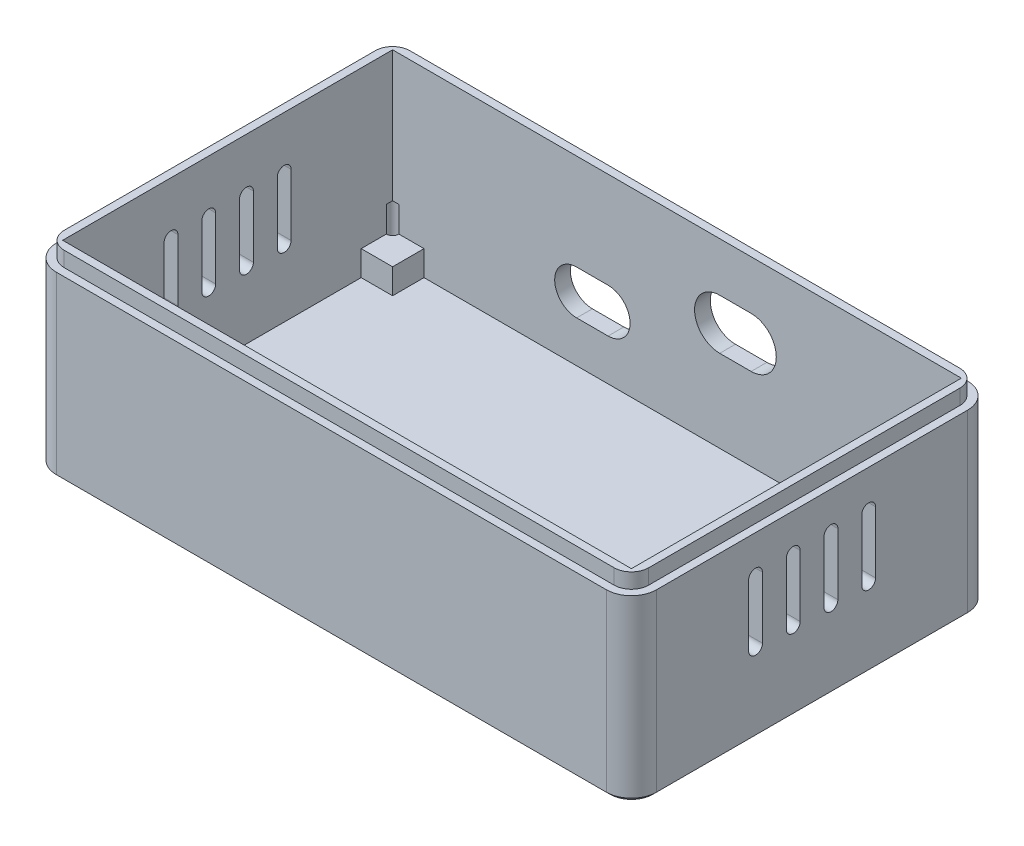
from build123d import *

# Parameters (mm, degrees)
CUERPO_DEPTH                  = 28.5
CROQUIS_HUECO_PCB_W           = 90.5
CROQUIS_HUECO_PCB_H           = 52.5
HUECO_PCB_DEPTH               = 26.5
CROQUIS_LABIO_W               = 90.5
CROQUIS_LABIO_H               = 52.5
LABIO_LIP_DEPTH               = 2.4
CROQUIS_APOYOS_W              = 5
CROQUIS_APOYOS_H              = 5
APOYOS_PCB_DEPTH              = 4
CROQUIS_ALIVIOS_R             = 1
ALIVIOS_ESQUINAS_DEPTH        = 8.1
SALIDAS_USB_Y_PANEL_DEPTH     = 64.729388825
VENTILAS_LATERALES_DEPTH      = 64.729388825
VENTILAS_LATERALES_DEPTH_BACK = 64.729388825
CHAFLAN_BASE_SIZE             = 0.6


with BuildPart() as part:
    # Croquis_contorno → Cuerpo (new body)
    with BuildSketch(Plane(origin=(0, 0, 0), x_dir=(1, 0, 0), z_dir=(0, 1, 0))):
        with BuildLine():
            Line((-43.75, -28.75), (43.75, -28.75))
            ThreePointArc((43.75, -28.75), (46.578427125, -27.578427125), (47.75, -24.75))
            Line((47.75, -24.75), (47.75, 24.75))
            ThreePointArc((47.75, 24.75), (46.578427125, 27.578427125), (43.75, 28.75))
            Line((43.75, 28.75), (-43.75, 28.75))
            ThreePointArc((-43.75, 28.75), (-46.578427125, 27.578427125), (-47.75, 24.75))
            Line((-47.75, 24.75), (-47.75, -24.75))
            ThreePointArc((-47.75, -24.75), (-46.578427125, -27.578427125), (-43.75, -28.75))
        make_face()
    extrude(amount=CUERPO_DEPTH)

    # Croquis_hueco_PCB → Hueco_PCB (cut)
    with BuildSketch(Plane(origin=(0, 28.5, 0), x_dir=(1, 0, 0), z_dir=(0, 1, 0))):
        Rectangle(CROQUIS_HUECO_PCB_W, CROQUIS_HUECO_PCB_H)
    extrude(amount=-HUECO_PCB_DEPTH, mode=Mode.SUBTRACT)

    # Croquis_labio → Labio_lip (add)
    with BuildSketch(Plane(origin=(0, 28.5, 0), x_dir=(1, 0, 0), z_dir=(0, 1, 0))):
        with BuildLine():
            Line((-43.75, -27.5), (43.75, -27.5))
            ThreePointArc((43.75, -27.5), (45.694543648, -26.694543648), (46.5, -24.75))
            Line((46.5, -24.75), (46.5, 24.75))
            ThreePointArc((46.5, 24.75), (45.694543648, 26.694543648), (43.75, 27.5))
            Line((43.75, 27.5), (-43.75, 27.5))
            ThreePointArc((-43.75, 27.5), (-45.694543648, 26.694543648), (-46.5, 24.75))
            Line((-46.5, 24.75), (-46.5, -24.75))
            ThreePointArc((-46.5, -24.75), (-45.694543648, -26.694543648), (-43.75, -27.5))
        make_face()
        Rectangle(CROQUIS_LABIO_W, CROQUIS_LABIO_H, mode=Mode.SUBTRACT)
    extrude(amount=LABIO_LIP_DEPTH)

    # Croquis_apoyos → Apoyos_PCB (add)
    with BuildSketch(Plane(origin=(0, 2, 0), x_dir=(1, 0, 0), z_dir=(0, 1, 0))):
        with Locations((-42.75, -23.75)):
            Rectangle(CROQUIS_APOYOS_W, CROQUIS_APOYOS_H)
        with Locations((-42.75, 23.75)):
            Rectangle(CROQUIS_APOYOS_W, CROQUIS_APOYOS_H)
        with Locations((42.75, -23.75)):
            Rectangle(CROQUIS_APOYOS_W, CROQUIS_APOYOS_H)
        with Locations((42.75, 23.75)):
            Rectangle(CROQUIS_APOYOS_W, CROQUIS_APOYOS_H)
    extrude(amount=APOYOS_PCB_DEPTH)

    # Croquis_alivios → Alivios_esquinas (cut)
    with BuildSketch(Plane(origin=(0, 2, 0), x_dir=(1, 0, 0), z_dir=(0, 1, 0))):
        with Locations((-45.25, -26.25)):
            Circle(CROQUIS_ALIVIOS_R)
        with Locations((-45.25, 26.25)):
            Circle(CROQUIS_ALIVIOS_R)
        with Locations((45.25, -26.25)):
            Circle(CROQUIS_ALIVIOS_R)
        with Locations((45.25, 26.25)):
            Circle(CROQUIS_ALIVIOS_R)
    extrude(amount=ALIVIOS_ESQUINAS_DEPTH, mode=Mode.SUBTRACT)

    # Croquis_salidas → Salidas_USB_y_panel (cut, through all)
    with BuildSketch(Plane.XY):
        with BuildLine():
            Line((6.8, 23.1), (11.8, 23.1))
            ThreePointArc((11.8, 23.1), (15.8, 19.1), (11.8, 15.1))
            Line((11.8, 15.1), (6.8, 15.1))
            ThreePointArc((6.8, 15.1), (2.8, 19.1), (6.8, 23.1))
        make_face()
        with BuildLine():
            Line((-15.96, 15.6), (-10.96, 15.6))
            ThreePointArc((-10.96, 15.6), (-7.46, 12.1), (-10.96, 8.6))
            Line((-10.96, 8.6), (-15.96, 8.6))
            ThreePointArc((-15.96, 8.6), (-19.46, 12.1), (-15.96, 15.6))
        make_face()
    extrude(amount=-SALIDAS_USB_Y_PANEL_DEPTH, mode=Mode.SUBTRACT)

    # Croquis_ventilas → Ventilas_laterales (cut, two sides: drawn at the far end of the back side and taken through both)
    with BuildSketch(Plane(origin=(0, 0, 0), x_dir=(0, 0, -1), z_dir=(1, 0, 0)).offset(-VENTILAS_LATERALES_DEPTH_BACK)):
        with BuildLine():
            Line((-10.1, 12.7), (-10.1, 22.5))
            ThreePointArc((-10.1, 22.5), (-9, 23.6), (-7.9, 22.5))
            Line((-7.9, 22.5), (-7.9, 12.7))
            ThreePointArc((-7.9, 12.7), (-9, 11.6), (-10.1, 12.7))
        make_face()
        with BuildLine():
            Line((-4.1, 12.7), (-4.1, 22.5))
            ThreePointArc((-4.1, 22.5), (-3, 23.6), (-1.9, 22.5))
            Line((-1.9, 22.5), (-1.9, 12.7))
            ThreePointArc((-1.9, 12.7), (-3, 11.6), (-4.1, 12.7))
        make_face()
        with BuildLine():
            Line((1.9, 12.7), (1.9, 22.5))
            ThreePointArc((1.9, 22.5), (3, 23.6), (4.1, 22.5))
            Line((4.1, 22.5), (4.1, 12.7))
            ThreePointArc((4.1, 12.7), (3, 11.6), (1.9, 12.7))
        make_face()
        with BuildLine():
            Line((7.9, 12.7), (7.9, 22.5))
            ThreePointArc((7.9, 22.5), (9, 23.6), (10.1, 22.5))
            Line((10.1, 22.5), (10.1, 12.7))
            ThreePointArc((10.1, 12.7), (9, 11.6), (7.9, 12.7))
        make_face()
    extrude(amount=VENTILAS_LATERALES_DEPTH + VENTILAS_LATERALES_DEPTH_BACK, mode=Mode.SUBTRACT)

    # Chaflan_base
    chaflan_base_edges = [part.edges().sort_by_distance(p)[0] for p in [
        (0, 0, 28.75),
        (46.578427125, 0, 27.578427125),
        (47.75, 0, 0),
        (46.578427125, 0, -27.578427125),
        (0, 0, -28.75),
        (-46.578427125, 0, -27.578427125),
        (-47.75, 0, 0),
        (-46.578427125, 0, 27.578427125),
    ]]
    chamfer(chaflan_base_edges, length=CHAFLAN_BASE_SIZE)


solid = part.part
